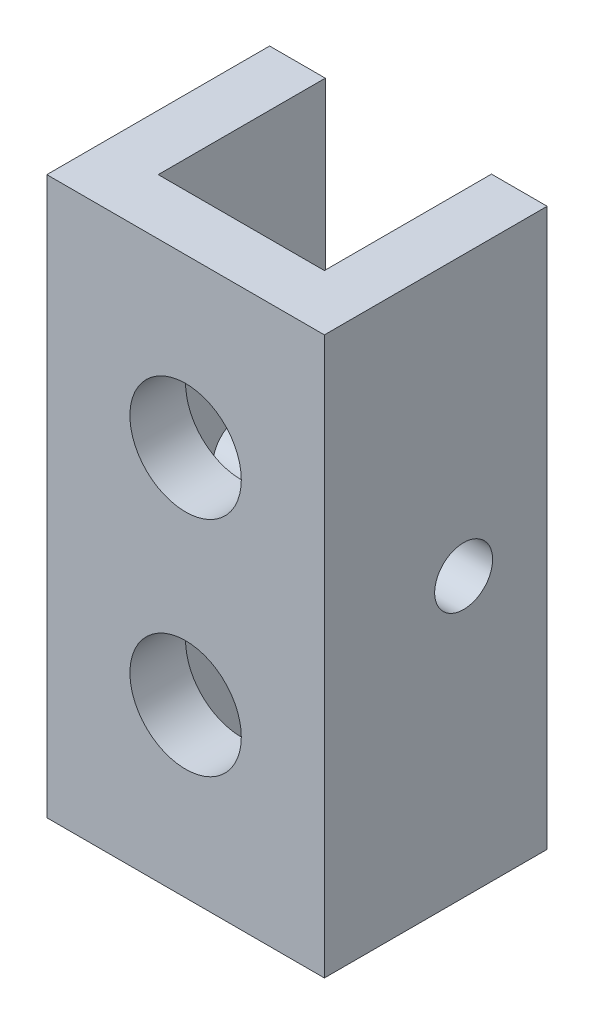
from build123d import *

# Parameters (mm, degrees)
BOSS_EXTRUDE1_DEPTH     = 63.5
SKETCH2_R               = 6.35
CUT_EXTRUDE1_DEPTH      = 76.357676181
CUT_EXTRUDE2_DEPTH      = 73.919254774
CUT_EXTRUDE2_DEPTH_BACK = 73.919254774
SKETCH5_R               = 3.302


with BuildPart() as part:
    # Sketch1 → Boss-Extrude1 (new body)
    with BuildSketch(Plane(origin=(0, 0, 0), x_dir=(1, 0, 0), z_dir=(0, 1, 0))):
        Polygon((0, 0), (0, 25.4), (6.35, 25.4), (6.35, 6.35), (25.294420667, 6.35), (25.294420667, 25.4), (31.644420667, 25.4), (31.644420667, 0), align=None)
    extrude(amount=BOSS_EXTRUDE1_DEPTH)

    # Sketch2 → Cut-Extrude1 (cut, through all)
    with BuildSketch(Plane.XY):
        with Locations((15.822210333, 44.45)):
            Circle(SKETCH2_R)
        with Locations((15.822210333, 19.05)):
            Circle(SKETCH2_R)
    extrude(amount=-CUT_EXTRUDE1_DEPTH, mode=Mode.SUBTRACT)

    # Sketch5 → Cut-Extrude2 (cut, two sides: drawn at the far end of the back side and taken through both)
    with BuildSketch(Plane(origin=(6.35, 0, 0), x_dir=(0, 0, -1), z_dir=(1, 0, 0)).offset(-CUT_EXTRUDE2_DEPTH_BACK)):
        with Locations((15.875, 31.75)):
            Circle(SKETCH5_R)
    extrude(amount=CUT_EXTRUDE2_DEPTH + CUT_EXTRUDE2_DEPTH_BACK, mode=Mode.SUBTRACT)


solid = part.part
